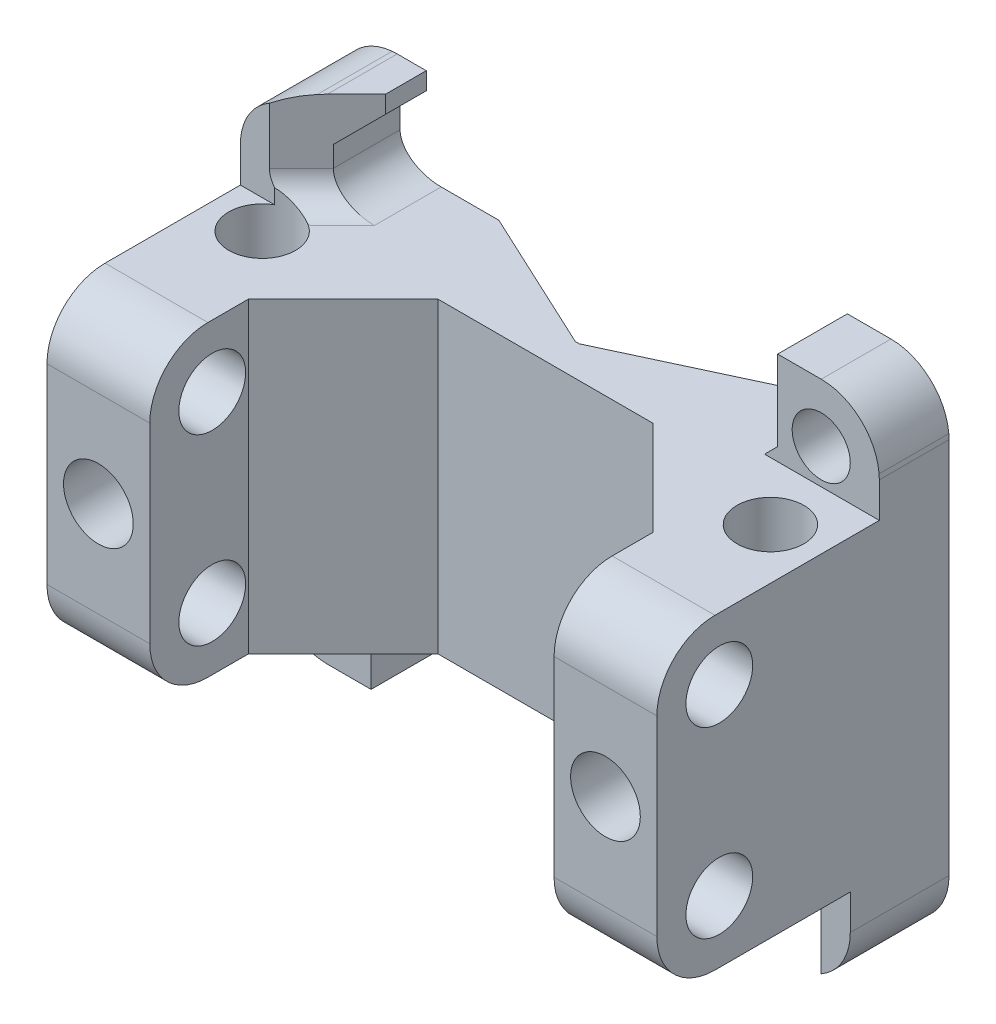
from build123d import *
from build123d.topology import SkipClean

# Parameters (mm, degrees)
SKETCH1_R                = 1
BOSS_EXTRUDE2_DEPTH      = 2.4
BOSS_EXTRUDE2_2_DEPTH    = 2.4
BOSS_EXTRUDE5_DEPTH      = 1
BOSS_EXTRUDE5_DEPTH_BACK = 0.1
CHAMFER1_SIZE            = 2
FILLET1_R                = 1
BOSS_EXTRUDE6_DEPTH      = 10.58
SKETCH9_R                = 1.15
CUT_EXTRUDE5_DEPTH       = 26.864775274
BOSS_EXTRUDE10_DEPTH     = 10.58
CHAMFER4_SIZE            = 3.3
SKETCH12_W               = 3.4
SKETCH12_H               = 10.58
SKETCH12_R               = 1.15
BOSS_EXTRUDE11_DEPTH     = 3.54
FILLET2_R                = 2
SKETCH13_R               = 1.2
CUT_EXTRUDE7_DEPTH       = 5.5
CHAMFER4_OF_MIRROR1_SIZE = 3.3
FILLET2_OF_MIRROR1_R     = 2
CHAMFER3_SIZE            = 1
SKETCH6_W                = 17.485786438
SKETCH6_H                = 0.6
BOSS_EXTRUDE8_DEPTH      = 2.3
SKETCH7_W                = 2
SKETCH7_H                = 0.6
CUT_EXTRUDE4_DEPTH       = 1
SKETCH11_W               = 10
SKETCH11_H               = 0.6
CUT_EXTRUDE6_DEPTH       = 2.3
CHAMFER5_SIZE            = 4.932365917
CHAMFER5_SIZE_2          = 2.3
CHAMFER6_SIZE            = 0.45


with BuildPart() as part:
    # Sketch1 → Boss-Extrude2 (new body)
    with BuildSketch(Plane.XY):
        with BuildLine():
            Line((0.6, 14), (0.6, 3.577))
            Line((0.6, 3.577), (3.5, 3.577))
            Line((3.5, 3.577), (3.5, 0))
            Line((3.5, 0), (2, 0))
            ThreePointArc((2, 0), (0.585786, 0.585786), (0, 2))
            Line((0, 2), (0, 15))
            ThreePointArc((0, 15), (0.52544374, 16.351186251), (1.82569, 16.9924))
            Line((1.82569, 16.9924), (2, 17))
            Line((2, 17), (3, 17))
            Line((3, 17), (3, 16.4))
            Line((3, 16.4), (0.6, 14))
        make_face()
        with Locations((1.999998506, 1.999998506)):
            Circle(SKETCH1_R, mode=Mode.SUBTRACT)
    extrude(amount=BOSS_EXTRUDE2_DEPTH)



with BuildPart() as body_2:
    # Sketch1 → Boss-Extrude2 2 (new body)
    with BuildSketch(Plane.XY):
        with BuildLine():
            Line((20.4, 3), (20.4, 13.79))
            Line((20.4, 13.79), (17.5, 13.79))
            Line((17.5, 13.79), (17.5, 17))
            Line((17.5, 17), (19, 17))
            ThreePointArc((19, 17), (20.351188195, 16.47455126), (20.9924, 15.1743))
            Line((20.9924, 15.1743), (21, 15))
            Line((21, 15), (21, 2))
            ThreePointArc((21, 2), (20.474549436, 0.648816495), (19.1743, 0.00760938))
            Line((19.1743, 0.00760938), (19, 0))
            Line((19, 0), (18, 0))
            Line((18, 0), (18, 0.6))
            Line((18, 0.6), (20.4, 3))
        make_face()
        with Locations((18.999999966, 14.999989488)):
            Circle(SKETCH1_R, mode=Mode.SUBTRACT)
    extrude(amount=BOSS_EXTRUDE2_2_DEPTH)


with BuildPart() as part_1:
    add(part.part)

    add(body_2.part)  # Boss-Extrude5 merges body 2
    # Sketch2 → Boss-Extrude5 (add, two sides: drawn at the far end of the back side and taken through both)
    with BuildSketch(Plane.XY.offset(2.4).offset(-BOSS_EXTRUDE5_DEPTH_BACK)):
        with BuildLine():
            Line((3, 13.79), (21, 13.79))
            Line((21, 13.79), (21, 2))
            ThreePointArc((21, 2), (20.474549436, 0.648816495), (19.1743, 0.00760938))
            Line((19.1743, 0.00760938), (19, 0))
            Line((19, 0), (18, 0))
            Line((18, 0), (18, 3.21))
            Line((18, 3.21), (0, 3.21))
            Line((0, 3.21), (0, 15))
            ThreePointArc((0, 15), (0.52544374, 16.351186251), (1.82569, 16.9924))
            Line((1.82569, 16.9924), (2, 17))
            Line((2, 17), (3, 17))
            Line((3, 17), (3, 13.79))
        make_face()
    extrude(amount=BOSS_EXTRUDE5_DEPTH + BOSS_EXTRUDE5_DEPTH_BACK)

    # Chamfer1
    # the kernel refuses this chamfer: 2 mm, written as the material it takes off along each edge
    with BuildSketch(Plane(origin=(18, -5.143365976, 3.4), x_dir=(-0.027495876610585623, 0, -0.9996219169112968), z_dir=(0, 1, 0)), Plane(origin=(3, 22.143365976, 3.4), x_dir=(0.02749587661058627, 0, -0.9996219169112968), z_dir=(0, -1, 0))) as chamfer1_piece_1:
        Polygon((CHAMFER1_SIZE * 0.999621916911, -CHAMFER1_SIZE * 0.0274958766106), (-CHAMFER1_SIZE * 0.0274958766106, -CHAMFER1_SIZE * 0.999621916911), (0, 0), align=None)
    extrude(amount=8.353365976, mode=Mode.SUBTRACT)

    # Fillet1
    fillet1_edges = [part_1.edges().sort_by_distance(p)[0] for p in [
        (19.45, 3.21, 2.85),
        (1.55, 13.79, 2.85),
    ]]
    fillet(fillet1_edges, radius=FILLET1_R)

    # Sketch3 → Boss-Extrude6 (add)
    with BuildSketch(Plane(origin=(0, 13.79, 0), x_dir=(1, 0, 0), z_dir=(0, 1, 0))):
        with BuildLine():
            Line((21, -4.4), (21, -3.4))
            Line((21, -3.4), (19.817890835, -3.4))
            ThreePointArc((19.817890835, -3.4), (19.25, -5.55), (18.682109165, -3.4))
            Line((18.682109165, -3.4), (17.5, -3.4))
            Line((17.5, -3.4), (17.5, -4.4))
            ThreePointArc((17.5, -4.4), (19.25, -6.15), (21, -4.4))
        make_face()
    boss_extrude6 = extrude(amount=-BOSS_EXTRUDE6_DEPTH)

    # Sketch9 → Cut-Extrude5 (cut, symmetric)
    with BuildSketch(Plane(origin=(0, 13.79, 0), x_dir=(1, 0, 0), z_dir=(0, 1, 0))):
        with Locations(Location((19.25, -4.4, 0), (0, 0, 270))):
            Circle(SKETCH9_R)
    cut_extrude5 = extrude(amount=CUT_EXTRUDE5_DEPTH, both=True, mode=Mode.SUBTRACT)

    # Sketch10 → Boss-Extrude10 (add)
    with SkipClean():  # the faces are left unmerged after this step: merging them gives an invalid solid
        with BuildSketch(Plane(origin=(0, 13.79, 0), x_dir=(1, 0, 0), z_dir=(0, 1, 0))):
            with BuildLine():
                Line((17.5, -6.659370346), (17.5, -4.4))
                Line((17.5, -4.4), (18.1, -4.4))
                ThreePointArc((18.1, -4.4), (19.25, -5.55), (20.4, -4.4))
                Line((20.4, -4.4), (21, -4.4))
                Line((21, -4.4), (21, -6.659370346))
                Line((21, -6.659370346), (17.5, -6.659370346))
            make_face()
        boss_extrude10 = extrude(amount=-BOSS_EXTRUDE10_DEPTH)

    # Chamfer4
    # the kernel refuses this chamfer: 3.3 mm, written as the material it adds along each edge
    with BuildSketch(Plane(origin=(17.5, 13.79, 3.4), x_dir=(-0.9996219169112966, 0, -0.027495876610586684), z_dir=(0, -1, 0))) as chamfer4_piece_1_section:
        Polygon((CHAMFER4_SIZE * 0.999621916911, -CHAMFER4_SIZE * 0.0274958766106), (-CHAMFER4_SIZE * 0.0274958766106, -CHAMFER4_SIZE * 0.999621916911), (0, 0), align=None)
    chamfer4_piece_1 = extrude(amount=10.58, mode=Mode.PRIVATE)
    chamfer4_piece_1 = split(chamfer4_piece_1, bisect_by=Plane(origin=(16.408327536, 8.5, 6.659370346), z_dir=(0, 0, -1)), keep=Keep.TOP, mode=Mode.PRIVATE)
    add(chamfer4_piece_1)

    # Sketch12 → Boss-Extrude11 (add)
    with SkipClean():  # the faces are left unmerged after this step: merging them gives an invalid solid
        with BuildSketch(Plane(origin=(21, 0, 0), x_dir=(0, 0, -1), z_dir=(1, 0, 0))):
            with Locations((-8.359370346, 8.5)):
                Rectangle(SKETCH12_W, SKETCH12_H)
            with Locations(Location((-7.909370346, 5.35, 0), (0, 0, 90))):
                Circle(SKETCH12_R, mode=Mode.SUBTRACT)
            with Locations(Location((-7.909370346, 11.65, 0), (0, 0, 270))):
                Circle(SKETCH12_R, mode=Mode.SUBTRACT)
        boss_extrude11 = extrude(amount=-BOSS_EXTRUDE11_DEPTH)

    # Fillet2
    fillet2_edges = [part_1.edges().sort_by_distance(p)[0] for p in [
        (19.23, 3.21, 10.059370346),
        (19.23, 13.79, 10.059370346),
    ]]
    fillet(fillet2_edges, radius=FILLET2_R)

    # Sketch13 → Cut-Extrude7 (cut)
    with BuildSketch(Plane.XY.offset(10.059370346)):
        with Locations((19.23, 8.5)):
            Circle(SKETCH13_R)
    cut_extrude7 = extrude(amount=-CUT_EXTRUDE7_DEPTH, mode=Mode.SUBTRACT)

    # Mirror1: Boss-Extrude6, Cut-Extrude5, Boss-Extrude10, Boss-Extrude11, Cut-Extrude7 across plane
    with SkipClean():  # the faces are left unmerged after this step: merging them gives an invalid solid
        add(boss_extrude6.mirror(Plane.ZY.offset(-10.5)))
        add(cut_extrude5.mirror(Plane.ZY.offset(-10.5)), mode=Mode.SUBTRACT)
        add(boss_extrude10.mirror(Plane.ZY.offset(-10.5)))
        add(boss_extrude11.mirror(Plane.ZY.offset(-10.5)))
        add(cut_extrude7.mirror(Plane.ZY.offset(-10.5)), mode=Mode.SUBTRACT)

    # Chamfer4 of Mirror1
    # the kernel refuses this chamfer: 3.3 mm, written as the material it adds along each edge
    with BuildSketch(Plane(origin=(3.5, 13.79, 3.4), x_dir=(0.9996219169112966, 1.0675155552485545e-15, -0.027495876610586698), z_dir=(0, -1, 0))) as chamfer4_of_mirror1_piece_1:
        Polygon((CHAMFER4_OF_MIRROR1_SIZE * 0.999621916911, CHAMFER4_OF_MIRROR1_SIZE * 0.0274958766106), (-CHAMFER4_OF_MIRROR1_SIZE * 0.0274958766106, CHAMFER4_OF_MIRROR1_SIZE * 0.999621916911), (0, 0), align=None)
    extrude(amount=10.58)

    # Fillet2 of Mirror1
    fillet2_of_mirror1_edges = [part_1.edges().sort_by_distance(p)[0] for p in [
        (1.77, 3.21, 10.059370346),
        (1.77, 13.79, 10.059370346),
    ]]
    fillet(fillet2_of_mirror1_edges, radius=FILLET2_OF_MIRROR1_R)

    # Chamfer3
    chamfer3_edges = [part_1.edges().sort_by_distance(p)[0] for p in [
        (0.6, 3.577, 1.15),
        (20.4, 13.79, 1.15),
    ]]
    chamfer(chamfer3_edges, length=CHAMFER3_SIZE)

    # Sketch6 → Boss-Extrude8 (add)
    with SkipClean():  # the faces are left unmerged after this step: merging them gives an invalid solid
        with BuildSketch(Plane(origin=(0, 0, 2.3), x_dir=(-1, 0, 0), z_dir=(0, 0, -1))):
            with Locations((-8.742893219, 3.51)):
                Rectangle(SKETCH6_W, SKETCH6_H)
            with BuildLine():
                ThreePointArc((-18.9, 2.21), (-18.451712264, 3.076025404), (-17.485786438, 3.21))
                Line((-17.485786438, 3.21), (-17.485786438, 3.81))
                Line((-17.485786438, 3.81), (-17.8, 3.674))
                Line((-17.8, 3.674), (-21, 3.674))
                Line((-21, 3.674), (-20.4, 3))
                Line((-20.4, 3), (-20.4, 1.5))
                Line((-20.4, 1.5), (-18.9, 1.5))
                Line((-18.9, 1.5), (-18.9, 2.21))
            make_face()
            with BuildLine():
                Line((-3.514213562, 13.79), (-17.5, 13.79))
                Line((-17.5, 13.79), (-17.5, 13.89))
                Line((-17.5, 13.89), (-21, 13.89))
                Line((-21, 13.89), (-21, 13.19))
                Line((-21, 13.19), (-0.5, 13.19))
                Line((-0.5, 13.19), (-0.5, 15.5))
                Line((-0.5, 15.5), (-2.1, 15.5))
                Line((-2.1, 15.5), (-2.1, 14.79))
                add(Edge.make_bspline(
                    [(-3.514213562, 13.79), (-2.1, 13.79), (-2.1, 14.79)],
                    knots=[4.71238898, 4.71238898, 4.71238898, 6.283185307, 6.283185307, 6.283185307], degree=2, weights=[1, 0.707106781, 1]))
            make_face()
        extrude(amount=BOSS_EXTRUDE8_DEPTH)

    # Sketch7 → Cut-Extrude4 (cut)
    with SkipClean():  # the faces are left unmerged after this step: merging them gives an invalid solid
        with BuildSketch(Plane(origin=(0, 0, 0), x_dir=(-1, 0, 0), z_dir=(0, 0, -1))):
            with Locations((-18.65, 13.49)):
                Rectangle(SKETCH7_W, SKETCH7_H)
        extrude(amount=-CUT_EXTRUDE4_DEPTH, mode=Mode.SUBTRACT)

    # Sketch11 → Cut-Extrude6 (cut)
    with SkipClean():  # the faces are left unmerged after this step: merging them gives an invalid solid
        with BuildSketch(Plane(origin=(0, 0, 0), x_dir=(-1, 0, 0), z_dir=(0, 0, -1))):
            with Locations((-10.5, 3.51)):
                Rectangle(SKETCH11_W, SKETCH11_H)
            with Locations((-10.5, 13.49)):
                Rectangle(SKETCH11_W, SKETCH11_H)
        extrude(amount=-CUT_EXTRUDE6_DEPTH, mode=Mode.SUBTRACT)

    # Chamfer5
    # the kernel refuses this chamfer: 4.932365917, 2.3 mm, written as the material it adds along each edge
    with BuildSketch(Plane(origin=(15.5, 3.21, 2.3), x_dir=(-0.9998669641130704, 0, 0.016311164131110237), z_dir=(0, 1, 0))) as chamfer5_piece_1_section:
        Polygon((CHAMFER5_SIZE * 0.999866964148, -CHAMFER5_SIZE * 0.0163111641317), (-CHAMFER5_SIZE_2 * 0.0163111641311, -CHAMFER5_SIZE_2 * 0.999866964113), (0, 0), align=None)
    chamfer5_piece_1 = extrude(amount=0.6, mode=Mode.PRIVATE)
    chamfer5_piece_1 = split(chamfer5_piece_1, bisect_by=Plane(origin=(13.827499222, 3.51, 0), z_dir=(0, 0, 1)), keep=Keep.TOP, mode=Mode.PRIVATE)
    add(chamfer5_piece_1)
    with BuildSketch(Plane(origin=(15.5, 3.21, 2.3), x_dir=(-0.9998669641130704, 0, 0.016311164131110237), z_dir=(0, 1, 0))) as chamfer5_piece_2_section:
        Polygon((CHAMFER5_SIZE * 0.999866964148, -CHAMFER5_SIZE * 0.0163111641317), (-CHAMFER5_SIZE_2 * 0.0163111641311, -CHAMFER5_SIZE_2 * 0.999866964113), (0, 0), align=None)
    chamfer5_piece_2 = extrude(amount=13.379639107, mode=Mode.PRIVATE)
    chamfer5_piece_2 = split(chamfer5_piece_2, bisect_by=Plane(origin=(13.827499222, 13.79, 1.578386063), z_dir=(0, -1, 0)), keep=Keep.TOP, mode=Mode.PRIVATE)
    chamfer5_piece_2 = split(chamfer5_piece_2, bisect_by=Plane(origin=(13.827499222, 13.19, 1.578386063), z_dir=(0, 1, 0)), keep=Keep.TOP, mode=Mode.PRIVATE)
    chamfer5_piece_2 = split(chamfer5_piece_2, bisect_by=Plane(origin=(13.827499222, 13.49, 0), z_dir=(0, 0, 1)), keep=Keep.TOP, mode=Mode.PRIVATE)
    add(chamfer5_piece_2)
    with BuildSketch(Plane(origin=(5.5, 16.589639107, 2.3), x_dir=(0.9998669641130704, 0, 0.01631116413111024), z_dir=(0, -1, 0))) as chamfer5_piece_3_section:
        Polygon((CHAMFER5_SIZE * 0.999866964148, -CHAMFER5_SIZE * 0.0163111641317), (-CHAMFER5_SIZE_2 * 0.0163111641311, -CHAMFER5_SIZE_2 * 0.999866964113), (0, 0), align=None)
    chamfer5_piece_3 = extrude(amount=13.379639107, mode=Mode.PRIVATE)
    chamfer5_piece_3 = split(chamfer5_piece_3, bisect_by=Plane(origin=(7.172500778, 13.49, 0), z_dir=(0, 0, 1)), keep=Keep.TOP, mode=Mode.PRIVATE)
    chamfer5_piece_3 = split(chamfer5_piece_3, bisect_by=Plane(origin=(7.172500778, 13.19, 1.578386063), z_dir=(0, 1, 0)), keep=Keep.TOP, mode=Mode.PRIVATE)
    chamfer5_piece_3 = split(chamfer5_piece_3, bisect_by=Plane(origin=(7.172500778, 13.79, 1.578386063), z_dir=(0, -1, 0)), keep=Keep.TOP, mode=Mode.PRIVATE)
    add(chamfer5_piece_3)
    with BuildSketch(Plane(origin=(5.5, 3.81, 2.3), x_dir=(0.9998669641130704, 0, 0.01631116413111024), z_dir=(0, -1, 0))) as chamfer5_piece_4_section:
        Polygon((CHAMFER5_SIZE * 0.999866964148, -CHAMFER5_SIZE * 0.0163111641317), (-CHAMFER5_SIZE_2 * 0.0163111641311, -CHAMFER5_SIZE_2 * 0.999866964113), (0, 0), align=None)
    chamfer5_piece_4 = extrude(amount=0.6, mode=Mode.PRIVATE)
    chamfer5_piece_4 = split(chamfer5_piece_4, bisect_by=Plane(origin=(7.172500778, 3.51, 0), z_dir=(0, 0, 1)), keep=Keep.TOP, mode=Mode.PRIVATE)
    add(chamfer5_piece_4)
    with BuildSketch(Plane(origin=(15.5, 0.410360893, 2.3), x_dir=(-0.9998669641130704, 0, 0.016311164131110237), z_dir=(0, 1, 0))) as chamfer5_piece_5_section:
        Polygon((CHAMFER5_SIZE * 0.999866964148, -CHAMFER5_SIZE * 0.0163111641317), (-CHAMFER5_SIZE_2 * 0.0163111641311, -CHAMFER5_SIZE_2 * 0.999866964113), (0, 0), align=None)
    chamfer5_piece_5 = extrude(amount=13.379639107, mode=Mode.PRIVATE)
    chamfer5_piece_5 = split(chamfer5_piece_5, bisect_by=Plane(origin=(13.827499222, 3.21, 1.578386063), z_dir=(0, 1, 0)), keep=Keep.TOP, mode=Mode.PRIVATE)
    chamfer5_piece_5 = split(chamfer5_piece_5, bisect_by=Plane(origin=(13.827499222, 3.81, 1.578386063), z_dir=(0, -1, 0)), keep=Keep.TOP, mode=Mode.PRIVATE)
    chamfer5_piece_5 = split(chamfer5_piece_5, bisect_by=Plane(origin=(13.827499222, 3.51, 0), z_dir=(0, 0, 1)), keep=Keep.TOP, mode=Mode.PRIVATE)
    add(chamfer5_piece_5)
    with BuildSketch(Plane(origin=(15.5, 13.19, 2.3), x_dir=(-0.9998669641130704, 0, 0.016311164131110237), z_dir=(0, 1, 0))) as chamfer5_piece_6_section:
        Polygon((CHAMFER5_SIZE * 0.999866964148, -CHAMFER5_SIZE * 0.0163111641317), (-CHAMFER5_SIZE_2 * 0.0163111641311, -CHAMFER5_SIZE_2 * 0.999866964113), (0, 0), align=None)
    chamfer5_piece_6 = extrude(amount=0.6, mode=Mode.PRIVATE)
    chamfer5_piece_6 = split(chamfer5_piece_6, bisect_by=Plane(origin=(13.827499222, 13.49, 0), z_dir=(0, 0, 1)), keep=Keep.TOP, mode=Mode.PRIVATE)
    add(chamfer5_piece_6)
    with BuildSketch(Plane(origin=(5.5, 13.79, 2.3), x_dir=(-0.07481330637060017, 0, -0.9971975577536775), z_dir=(0, -1, 0))) as chamfer5_piece_7_section:
        Polygon((CHAMFER5_SIZE_2 * 0.997197557754, CHAMFER5_SIZE_2 * 0.0748133063706), (-CHAMFER5_SIZE * 0.0748133063732, CHAMFER5_SIZE * 0.997197557788), (0, 0), align=None)
    chamfer5_piece_7 = extrude(amount=0.6, mode=Mode.PRIVATE)
    chamfer5_piece_7 = split(chamfer5_piece_7, bisect_by=Plane(origin=(7.172500778, 13.49, 0), z_dir=(0, 0, 1)), keep=Keep.TOP, mode=Mode.PRIVATE)
    add(chamfer5_piece_7)
    with BuildSketch(Plane(origin=(5.5, 13.79, 2.3), x_dir=(-0.07481330637060017, 0, -0.9971975577536775), z_dir=(0, -1, 0))) as chamfer5_piece_8_section:
        Polygon((CHAMFER5_SIZE_2 * 0.997197557754, CHAMFER5_SIZE_2 * 0.0748133063706), (-CHAMFER5_SIZE * 0.0748133063732, CHAMFER5_SIZE * 0.997197557788), (0, 0), align=None)
    chamfer5_piece_8 = extrude(amount=13.379639107, mode=Mode.PRIVATE)
    chamfer5_piece_8 = split(chamfer5_piece_8, bisect_by=Plane(origin=(7.172500778, 3.51, 0), z_dir=(0, 0, 1)), keep=Keep.TOP, mode=Mode.PRIVATE)
    chamfer5_piece_8 = split(chamfer5_piece_8, bisect_by=Plane(origin=(7.172500778, 3.21, 1.578386063), z_dir=(0, 1, 0)), keep=Keep.TOP, mode=Mode.PRIVATE)
    chamfer5_piece_8 = split(chamfer5_piece_8, bisect_by=Plane(origin=(7.172500778, 3.81, 1.578386063), z_dir=(0, -1, 0)), keep=Keep.TOP, mode=Mode.PRIVATE)
    add(chamfer5_piece_8)

    # Chamfer6
    # the kernel refuses this chamfer: 0.45 mm, written as the material it adds along each edge
    with BuildSketch(Plane(origin=(17.5, 13.79, 0), x_dir=(-0.9996219169112969, -0.027495876610584467, 0), z_dir=(0, 0, 1))) as chamfer6_piece_1:
        Polygon((CHAMFER6_SIZE * 0.999621916911, -CHAMFER6_SIZE * 0.0274958766106), (-CHAMFER6_SIZE * 0.0274958766106, -CHAMFER6_SIZE * 0.999621916911), (0, 0), align=None)
    extrude(amount=2.3)
    with BuildSketch(Plane(origin=(17.5, 13.79, 2.3), x_dir=(-0.9996219169112965, -0.027495876610592135, 0), z_dir=(0, 0, 1))) as chamfer6_piece_2:
        Polygon((CHAMFER6_SIZE * 0.999621916911, -CHAMFER6_SIZE * 0.0274958766106), (-CHAMFER6_SIZE * 0.0274958766106, -CHAMFER6_SIZE * 0.999621916911), (0, 0), align=None)
    extrude(amount=0.1)


solid = part_1.part
